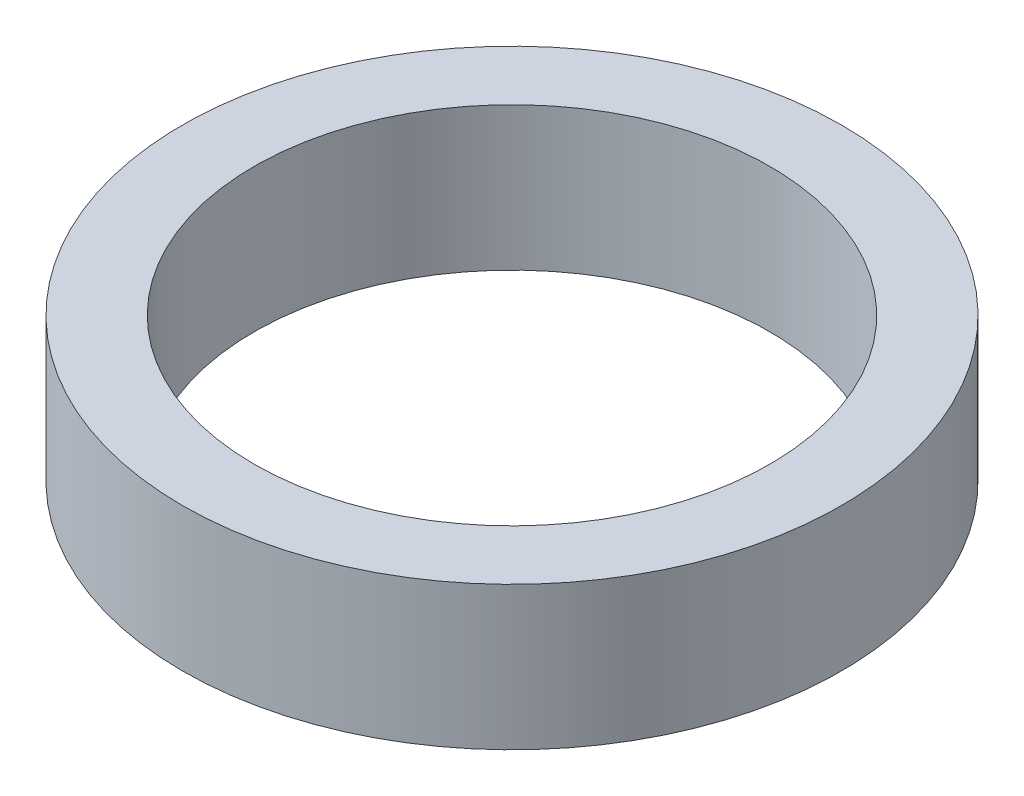
from build123d import *

# Parameters (mm, degrees)
SKETCH1_R           = 29.21
SKETCH1_R_2         = 22.86
BOSS_EXTRUDE2_DEPTH = 12.7


with BuildPart() as part:
    # Sketch1 → Boss-Extrude2 (new body)
    with BuildSketch(Plane(origin=(0, 0, 0), x_dir=(1, 0, 0), z_dir=(0, 1, 0))):
        Circle(SKETCH1_R)
        Circle(SKETCH1_R_2, mode=Mode.SUBTRACT)
    extrude(amount=BOSS_EXTRUDE2_DEPTH)

    # Sketch2 → Cut-Revolve1 (revolve, cut)
    with BuildSketch(Plane(origin=(0, 0, 0), x_dir=(0, 0, -1), z_dir=(1, 0, 0))):
        with BuildLine():
            Line((-29.145851973, 0), (-22.924148027, 0))
            ThreePointArc((-22.924148027, 0), (-26.035, 2.54), (-29.145851973, 0))
        make_face()
    revolve(axis=Axis((0, 0, 0), (0, 1, 0)), mode=Mode.SUBTRACT)


solid = part.part
